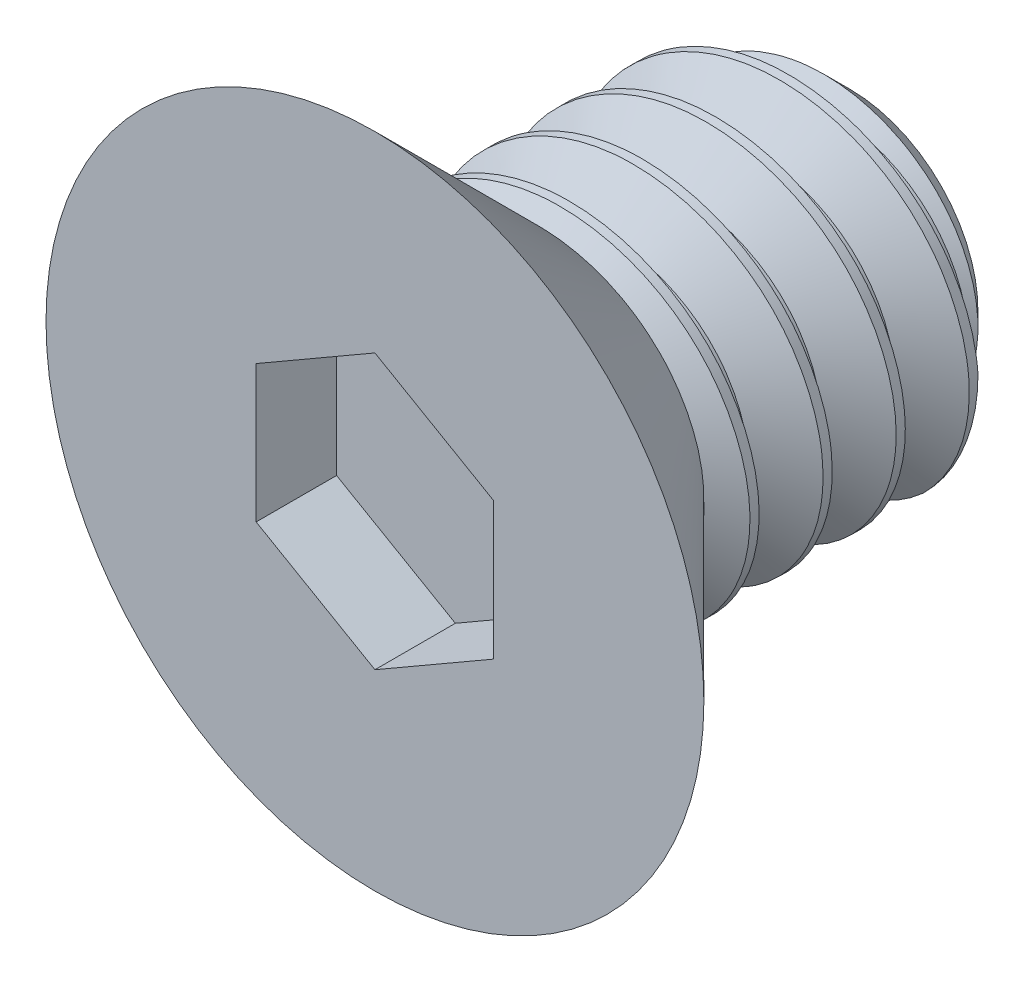
from build123d import *

# Parameters (mm, degrees)
SKETCH1_W          = 3
SKETCH1_H          = 1
CHAMFER1_SIZE      = 0.3
CUT_SWEEP1_PITCH   = 0.4
CUT_EXTRUDE2_DEPTH = 0.84
SKETCH11_W         = 0.4
SKETCH11_H         = 2


with BuildPart() as part:
    # Sketch1 → Revolve1 (revolve)
    with BuildSketch(Plane(origin=(0, 0, 0), x_dir=(0, 0, -1), z_dir=(1, 0, 0))):
        with Locations((1.5, 0.5)):
            Rectangle(SKETCH1_W, SKETCH1_H)
    revolve(axis=Axis((0, 0, -3), (0, 0, 1)))

    # Chamfer1
    chamfer1_edges = [part.edges().sort_by_distance(p)[0] for p in [
        (0, -1, -3),
    ]]
    chamfer(chamfer1_edges, length=CHAMFER1_SIZE)

    # Cut-Sweep1: arcs per turn and ends read off the stored shape
    # Cut-Sweep1: the profile of Sketch2 profile screwed along a right-hand helix through 9 turns, 6 arcs to a turn; built about Z, then put on its axis
    cut_sweep1_z = Axis((0, 0, 0), (0, 0, 1))
    cut_sweep1_corners = [(1.0006, 0, 0.00034641), (1.0006, 0, -0.35034641), (0.740192379, 0, -0.2), (0.740192379, 0, -0.15)]
    with BuildLine(mode=Mode.PRIVATE) as cut_sweep1_profile:
        Line(cut_sweep1_corners[0], cut_sweep1_corners[1])
        Line(cut_sweep1_corners[1], cut_sweep1_corners[2])
        Line(cut_sweep1_corners[2], cut_sweep1_corners[3])
        Line(cut_sweep1_corners[3], cut_sweep1_corners[0])
    cut_sweep1_cap = Face(cut_sweep1_profile.wire())
    cut_sweep1_turn_angles = [0, 30, 60, 90, 120, 150, 180, 210, 240, 270, 300, 330, 360]
    cut_sweep1_turn_weights = [1, 0.8660254037844387, 1, 0.8660254037844387, 1, 0.8660254037844387, 1, 0.8660254037844387, 1, 0.8660254037844387, 1, 0.8660254037844387, 1]
    cut_sweep1_turn_rails = [Edge.make_bspline([Vector(p[0], p[1], 0).rotate(cut_sweep1_z, cut_sweep1_turn_angles[k]) / cut_sweep1_turn_weights[k] + Vector(0, 0, p[2] + CUT_SWEEP1_PITCH * cut_sweep1_turn_angles[k] / 360) for k in range(13)], [0, 0, 0, 1, 1, 2, 2, 3, 3, 4, 4, 5, 5, 6, 6, 6], 2, cut_sweep1_turn_weights) for p in cut_sweep1_corners]
    cut_sweep1_turn_sides = [Face.make_surface_from_curves(cut_sweep1_turn_rails[p[0]], cut_sweep1_turn_rails[p[1]]) for p in [(0, 1), (1, 2), (2, 3), (3, 0)]]
    cut_sweep1 = Plane(origin=(0, 0, -3), x_dir=(0, 1, 0), z_dir=(0, 0, 1)) * Solid(Shell([*[p.moved(Location((0, 0, CUT_SWEEP1_PITCH * i))) for i in range(9) for p in cut_sweep1_turn_sides], cut_sweep1_cap, cut_sweep1_cap.rotate(cut_sweep1_z, 3240).moved(Location((0, 0, CUT_SWEEP1_PITCH * 3240 / 360)))]))
    add(cut_sweep1, mode=Mode.SUBTRACT)

    # Sketch7 → Revolve2 (revolve)
    with BuildSketch(Plane(origin=(0, 0, 0), x_dir=(0, 0, -1), z_dir=(1, 0, 0)), mode=Mode.PRIVATE) as revolve2_sk:
        Polygon((0, 2), (0.2, 2), (1.2, 1), (1.2, 0), (0, 0), align=None)
    revolve(revolve2_sk.sketch.rotate(Axis((0, 0, 0), (0, 0, -1)), 189.336081704), axis=Axis((0, 0, 0), (0, 0, -1)))

    # Boss-Extrude1 cone 1 section (through the dimple's axis) → Boss-Extrude1 (revolve)
    with BuildSketch(Plane(origin=(0, 0, -1.2), x_dir=(0, -1, 0), z_dir=(1, 0, 0))):
        Polygon((0, 0), (1, 0), (0, 1), align=None)
    revolve(axis=Axis((0, 0, -1.2), (0, 0, -1)))

    # Sketch5 → Cut-Extrude2 (cut)
    with BuildSketch(Plane.XY):
        Polygon((0.65, -0.375277675), (0.65, 0.375277675), (0, 0.75055535), (-0.65, 0.375277675), (-0.65, -0.375277675), (0, -0.75055535), align=None)
    extrude(amount=-CUT_EXTRUDE2_DEPTH, mode=Mode.SUBTRACT)

    # Cut-Extrude3 cone 1 section (through the dimple's axis) → Cut-Extrude3 (revolve, cut)
    with BuildSketch(Plane(origin=(0, 0, 0), x_dir=(0, -1, 0), z_dir=(1, 0, 0))):
        Polygon((0, 0), (0.75055535, 0), (0, 0.75055535), align=None)
    revolve(axis=Axis((0, 0, 0), (0, 0, -1)), mode=Mode.SUBTRACT)

    # Sketch11 → Cut-Revolve1 (revolve, cut)
    with BuildSketch(Plane(origin=(0, 0, 0), x_dir=(0, 0, -1), z_dir=(1, 0, 0)), mode=Mode.PRIVATE) as cut_revolve1_sk:
        with Locations((0.2, 1)):
            Rectangle(SKETCH11_W, SKETCH11_H)
    revolve(cut_revolve1_sk.sketch.rotate(Axis((0, 0, -3), (0, 0, 1)), 170.663918296), axis=Axis((0, 0, -3), (0, 0, 1)), mode=Mode.SUBTRACT)


solid = part.part
